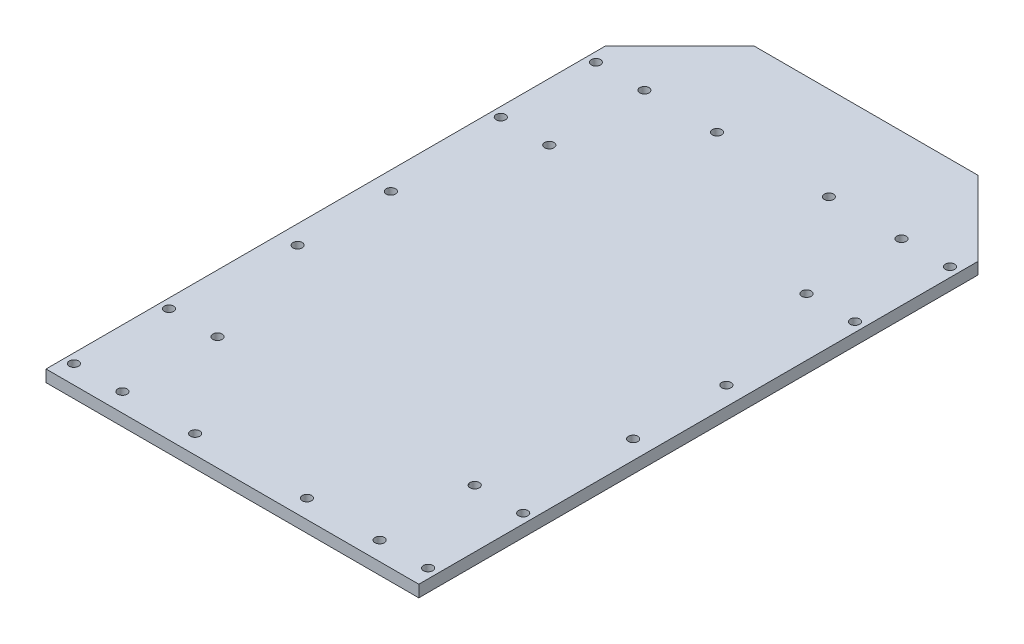
from build123d import *

# Parameters (mm, degrees)
SKETCH1_R           = 2.5
BOSS_EXTRUDE1_DEPTH = 6.35
SKETCH2_R           = 2.5
CUT_EXTRUDE1_DEPTH  = 10


with BuildPart() as part:
    # Sketch1 → Boss-Extrude1 (new body)
    with BuildSketch(Plane(origin=(0, 0, 0), x_dir=(1, 0, 0), z_dir=(0, 1, 0))):
        Polygon((-160, 340), (-200, 300), (-200, 0), (0, 0), (0, 300), (-40, 340), align=None)
        with Locations((-5, 290)):
            Circle(SKETCH1_R, mode=Mode.SUBTRACT)
        with Locations((-195, 10)):
            Circle(SKETCH1_R, mode=Mode.SUBTRACT)
        with Locations((-169, 10)):
            Circle(SKETCH1_R, mode=Mode.SUBTRACT)
        with Locations((-195, 61)):
            Circle(SKETCH1_R, mode=Mode.SUBTRACT)
        with Locations((-169, 61)):
            Circle(SKETCH1_R, mode=Mode.SUBTRACT)
        with Locations((-31, 10)):
            Circle(SKETCH1_R, mode=Mode.SUBTRACT)
        with Locations((-5, 10)):
            Circle(SKETCH1_R, mode=Mode.SUBTRACT)
        with Locations((-31, 61)):
            Circle(SKETCH1_R, mode=Mode.SUBTRACT)
        with Locations((-5, 61)):
            Circle(SKETCH1_R, mode=Mode.SUBTRACT)
        with Locations((-195, 239)):
            Circle(SKETCH1_R, mode=Mode.SUBTRACT)
        with Locations((-169, 239)):
            Circle(SKETCH1_R, mode=Mode.SUBTRACT)
        with Locations((-195, 290)):
            Circle(SKETCH1_R, mode=Mode.SUBTRACT)
        with Locations((-169, 290)):
            Circle(SKETCH1_R, mode=Mode.SUBTRACT)
        with Locations((-31, 239)):
            Circle(SKETCH1_R, mode=Mode.SUBTRACT)
        with Locations((-5, 239)):
            Circle(SKETCH1_R, mode=Mode.SUBTRACT)
        with Locations((-31, 290)):
            Circle(SKETCH1_R, mode=Mode.SUBTRACT)
    extrude(amount=BOSS_EXTRUDE1_DEPTH)

    # Sketch2 → Cut-Extrude1 (cut)
    with BuildSketch(Plane(origin=(0, 6.35, 0), x_dir=(1, 0, 0), z_dir=(0, 1, 0))):
        with Locations((-70, 10)):
            Circle(SKETCH2_R)
        with Locations((-10, 125)):
            Circle(SKETCH2_R)
        with Locations((-190, 125)):
            Circle(SKETCH2_R)
        with Locations((-130, 10)):
            Circle(SKETCH2_R)
        with Locations((-70, 290)):
            Circle(SKETCH2_R)
        with Locations((-10, 175)):
            Circle(SKETCH2_R)
        with Locations((-190, 175)):
            Circle(SKETCH2_R)
        with Locations((-130, 290)):
            Circle(SKETCH2_R)
    extrude(amount=-CUT_EXTRUDE1_DEPTH, mode=Mode.SUBTRACT)


solid = part.part
